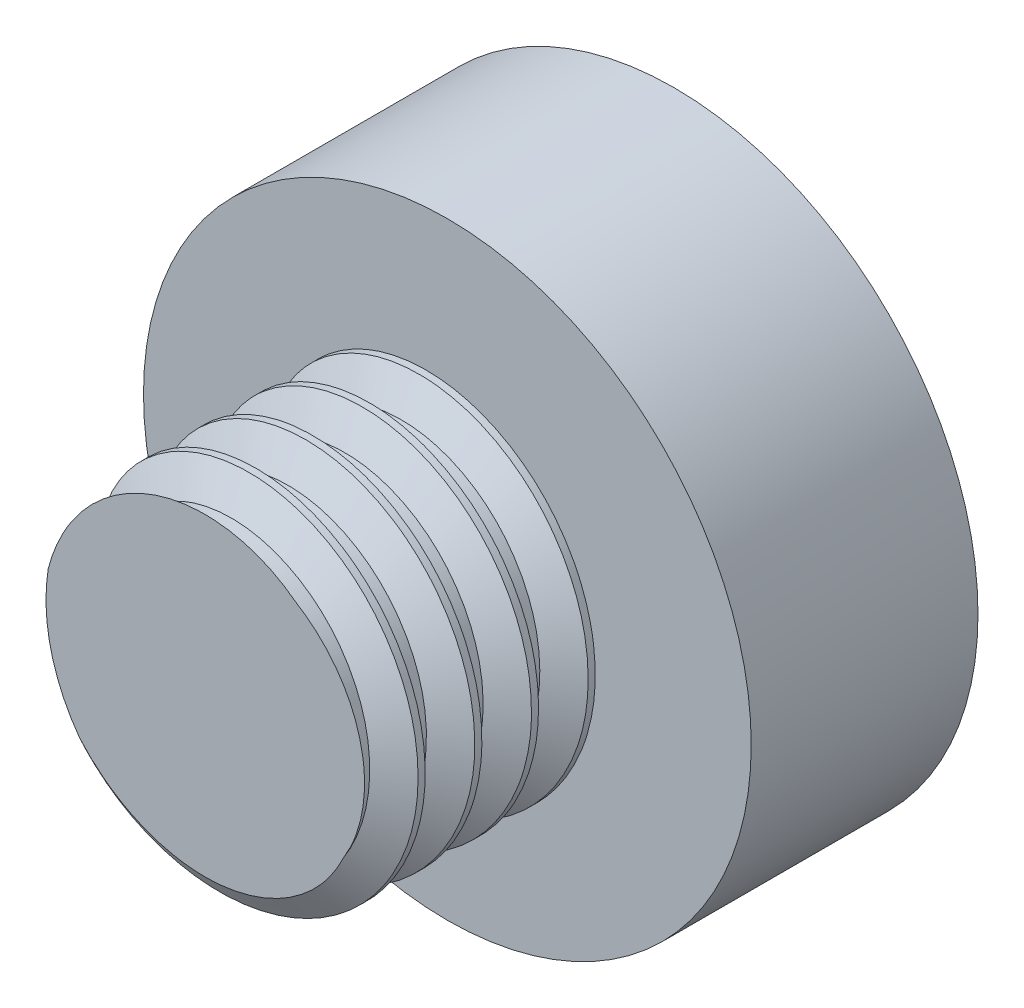
from build123d import *

# Parameters (mm, degrees)
SKETCH1_R           = 17.018
BOSS_EXTRUDE1_DEPTH = 12.7
SKETCH2_R           = 9.779
BOSS_EXTRUDE2_DEPTH = 12.7
THREAD1_PITCH       = 3.175
THREAD1_FROM        = 7.6201


with BuildPart() as part:
    # Sketch1 → Boss-Extrude1 (new body)
    with BuildSketch(Plane.XY):
        Circle(SKETCH1_R)
    extrude(amount=BOSS_EXTRUDE1_DEPTH)

    # Sketch2 → Boss-Extrude2 (add)
    with BuildSketch(Plane.XY.offset(12.7)):
        Circle(SKETCH2_R)
    extrude(amount=BOSS_EXTRUDE2_DEPTH)

    # Thread1: arcs per turn and ends read off the stored shape
    # Thread1: the profile of Thread Profile1 profile screwed along a left-hand helix through 9.5 turns, 12 arcs to a turn; built about Z, then put on its axis
    thread1_z = Axis((0, 0, 0), (0, 0, 1))
    thread1_corners = [(9.7793, 0, -0.000173205), (9.7793, 0, 2.778298196), (8.060480847, 0, 1.785937496), (8.060480847, 0, 0.992187496)]
    with BuildLine(mode=Mode.PRIVATE) as thread1_profile:
        Line(thread1_corners[0], thread1_corners[1])
        Line(thread1_corners[1], thread1_corners[2])
        Line(thread1_corners[2], thread1_corners[3])
        Line(thread1_corners[3], thread1_corners[0])
    thread1_cap = Face(thread1_profile.wire())
    thread1_turn_angles = [0, -15, -30, -45, -60, -75, -90, -105, -120, -135, -150, -165, -180, -195, -210, -225, -240, -255, -270, -285, -300, -315, -330, -345, -360]
    thread1_turn_weights = [1, 0.9659258262890683, 1, 0.9659258262890683, 1, 0.9659258262890683, 1, 0.9659258262890683, 1, 0.9659258262890683, 1, 0.9659258262890683, 1, 0.9659258262890683, 1, 0.9659258262890683, 1, 0.9659258262890683, 1, 0.9659258262890683, 1, 0.9659258262890683, 1, 0.9659258262890683, 1]
    thread1_turn_rails = [Edge.make_bspline([Vector(p[0], p[1], 0).rotate(thread1_z, thread1_turn_angles[k]) / thread1_turn_weights[k] + Vector(0, 0, p[2] + -THREAD1_PITCH * thread1_turn_angles[k] / 360) for k in range(25)], [0, 0, 0, 1, 1, 2, 2, 3, 3, 4, 4, 5, 5, 6, 6, 7, 7, 8, 8, 9, 9, 10, 10, 11, 11, 12, 12, 12], 2, thread1_turn_weights) for p in thread1_corners]
    thread1_turn_sides = [Face.make_surface_from_curves(thread1_turn_rails[p[0]], thread1_turn_rails[p[1]]) for p in [(0, 1), (1, 2), (2, 3), (3, 0)]]
    thread1_last_angles = [-3240, -3255, -3270, -3285, -3300, -3315, -3330, -3345, -3360, -3375, -3390, -3405, -3420]
    thread1_last_weights = [1, 0.9659258262890683, 1, 0.9659258262890683, 1, 0.9659258262890683, 1, 0.9659258262890683, 1, 0.9659258262890683, 1, 0.9659258262890683, 1]
    thread1_last_rails = [Edge.make_bspline([Vector(p[0], p[1], 0).rotate(thread1_z, thread1_last_angles[k]) / thread1_last_weights[k] + Vector(0, 0, p[2] + -THREAD1_PITCH * thread1_last_angles[k] / 360) for k in range(13)], [0, 0, 0, 1, 1, 2, 2, 3, 3, 4, 4, 5, 5, 6, 6, 6], 2, thread1_last_weights) for p in thread1_corners]
    thread1_last_sides = [Face.make_surface_from_curves(thread1_last_rails[p[0]], thread1_last_rails[p[1]]) for p in [(0, 1), (1, 2), (2, 3), (3, 0)]]
    thread1 = Plane(origin=(0, 0, 5.0799), x_dir=(1, 0, 0), z_dir=(0, 0, 1)) * split(Solid(Shell([*[p.moved(Location((0, 0, THREAD1_PITCH * i))) for i in range(9) for p in thread1_turn_sides], *thread1_last_sides, thread1_cap, thread1_cap.rotate(thread1_z, -3420).moved(Location((0, 0, -THREAD1_PITCH * -3420 / 360)))])), bisect_by=Plane.XY.offset(THREAD1_FROM), keep=Keep.TOP, mode=Mode.PRIVATE)
    add(thread1, mode=Mode.SUBTRACT)


solid = part.part
